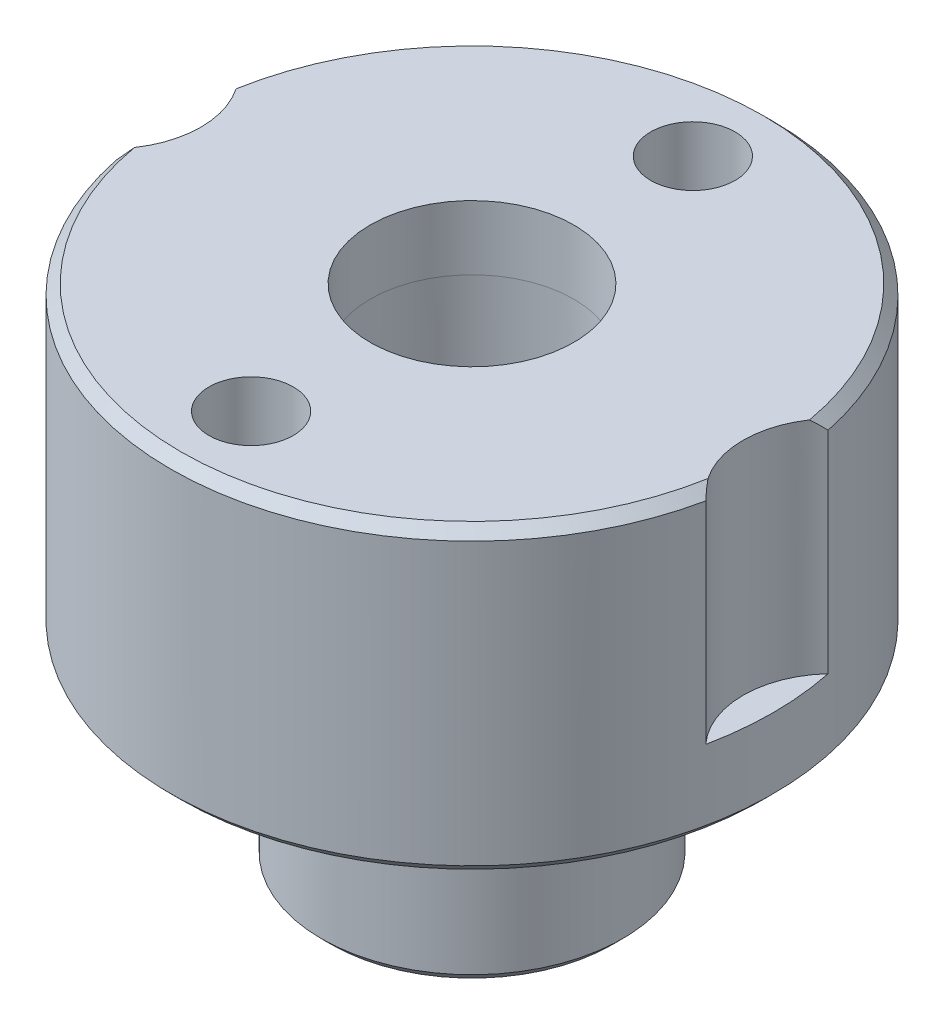
from build123d import *

# Parameters (mm, degrees)
SKETCH2_R             = 5.07
CUT_EXTRUDE1_DEPTH    = 33.787192622
CHAMFER1_SIZE         = 0.5
FILLET1_R             = 0.2
SKETCH3_R             = 4.5
CUT_EXTRUDE2_DEPTH    = 11
M5_TAPPED_HOLE1_D     = 4.2
M5_TAPPED_HOLE1_DEPTH = 10
M5_TAPPED_HOLE1_TIP   = 1.2618073


# Read off the part's stored shape, not the designer's step: Draft1
with BuildPart() as part:
    # Sketch1 → Revolve1 (revolve)
    with BuildSketch(Plane.XY, mode=Mode.PRIVATE) as revolve1_sk:
        Polygon((0, 0), (15, 0), (15, -15), (7.5, -15), (7.5, -25), (0, -25), align=None)
    revolve(revolve1_sk.sketch.rotate(Axis((0, -30, 0), (0, 1, 0)), 90), axis=Axis((0, -30, 0), (0, 1, 0)))

    # Sketch2 → Cut-Extrude1 (cut, through all)
    with BuildSketch(Plane(origin=(0, 0, 0), x_dir=(1, 0, 0), z_dir=(0, 1, 0))):
        with Locations(Location((0, 0, 0), (0, 0, 180))):
            Circle(SKETCH2_R)
    extrude(amount=-CUT_EXTRUDE1_DEPTH, mode=Mode.SUBTRACT)

    # Chamfer1
    chamfer1_edges = [part.edges().sort_by_distance(p)[0] for p in [
        (0, -25, 7.5),
        (0, -15, 15),
        (0, 0, 15),
    ]]
    chamfer(chamfer1_edges, length=CHAMFER1_SIZE)

    # Fillet1
    fillet1_edges = [part.edges().sort_by_distance(p)[0] for p in [
        (0, -15, 7.5),
    ]]
    fillet(fillet1_edges, radius=FILLET1_R)

    # Draft1 outline → Draft1 (revolve, cut)
    with BuildSketch(Plane.XY):
        Polygon((5.450520415, -25), (5.07, -3.2), (5.07, -25), align=None)
    revolve(axis=Axis((0, 0, 0), (0, 1, 0)), mode=Mode.SUBTRACT)

    # Sketch3 → Cut-Extrude2 (cut)
    with BuildSketch(Plane(origin=(0, 0, 0), x_dir=(1, 0, 0), z_dir=(0, 1, 0))):
        with Locations((-18, 0)):
            Circle(SKETCH3_R)
    cut_extrude2 = extrude(amount=-CUT_EXTRUDE2_DEPTH, mode=Mode.SUBTRACT)

    # Mirror1: Cut-Extrude2 across plane
    add(cut_extrude2.mirror(Plane(origin=(0, 0, 0), x_dir=(0, 0, 1), z_dir=(1, 0, 0))), mode=Mode.SUBTRACT)

    # M5 Tapped Hole1
    with Locations(Plane(origin=(0, 0, 0), x_dir=(1, 0, 0), z_dir=(0, 1, 0))):
        with Locations((0, 11), (0, -11)):
            Hole(M5_TAPPED_HOLE1_D / 2, depth=M5_TAPPED_HOLE1_DEPTH)
            with Locations((0, 0, -(M5_TAPPED_HOLE1_DEPTH + M5_TAPPED_HOLE1_TIP / 2))):  # 118° drill point
                Cone(0, M5_TAPPED_HOLE1_D / 2, M5_TAPPED_HOLE1_TIP, mode=Mode.SUBTRACT)


solid = part.part
